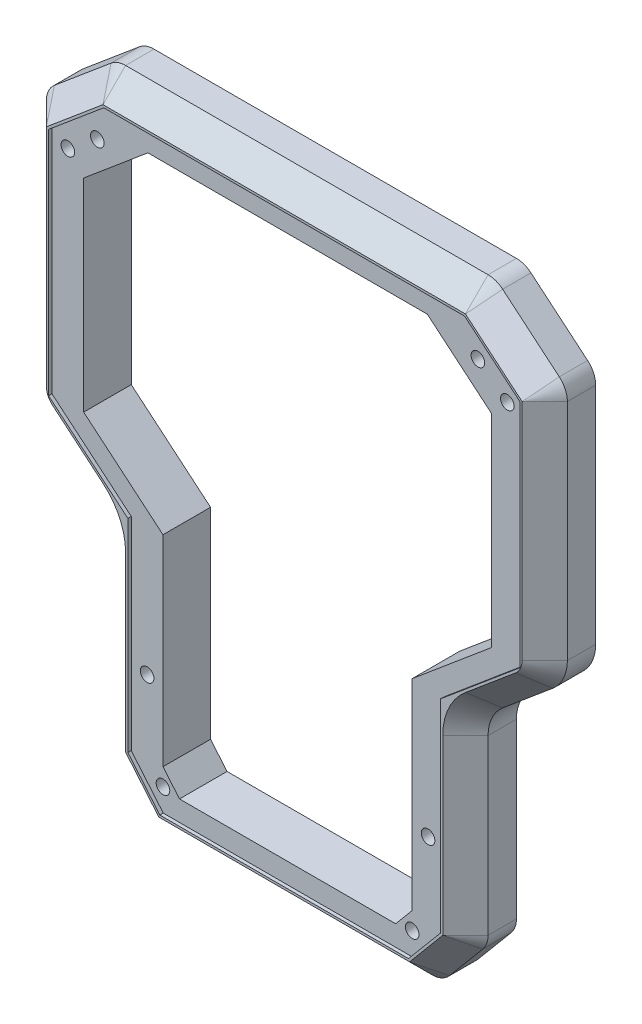
from build123d import *

# Parameters (mm, degrees)
RESSALTO_EXTRUS_O1_DEPTH = 22.5
CHANFRO1_SIZE            = 10
CORTE_EXTRUS_O1_REACH    = 305.531
ESBO_O3_W                = 1139.230904301
ESBO_O3_H                = 709.798033895
CORTE_EXTRUS_O5_DEPTH    = 1.5
ESBO_O5_R                = 3
CORTE_EXTRUS_O6_DEPTH    = 304.423796035
CORTE_EXTRUS_O8_DEPTH    = 10


with BuildPart() as part:
    # Esboço1 → Ressalto-extrusão1 (new, symmetric)
    with BuildSketch(Plane.XY):
        with BuildLine():
            Line((-55.336923418, 0), (55.336923418, 0))
            ThreePointArc((55.336923418, 0), (59.563106036, 0.93692213), (62.99736785, 3.572123903))
            Line((62.99736785, 3.572123903), (77.660444431, 21.046898098))
            ThreePointArc((77.660444431, 21.046898098), (79.396926208, 24.054572761), (80, 27.474774195))
            Line((80, 27.474774195), (80, 103.835071852))
            ThreePointArc((80, 103.835071852), (81.685949179, 111.43989715), (86.427876097, 117.619696626))
            Line((86.427876097, 117.619696626), (108.572123903, 136.200926793))
            ThreePointArc((108.572123903, 136.200926793), (113.314050821, 142.380726268), (115, 149.985551567))
            Line((115, 149.985551567), (115, 249.022509221))
            ThreePointArc((115, 249.022509221), (114.06307787, 253.248691838), (111.427876097, 256.682953652))
            Line((111.427876097, 256.682953652), (86.427876097, 277.660444431))
            ThreePointArc((86.427876097, 277.660444431), (83.420201433, 279.396926208), (80, 280))
            Line((80, 280), (-80, 280))
            ThreePointArc((-80, 280), (-83.420201433, 279.396926208), (-86.427876097, 277.660444431))
            Line((-86.427876097, 277.660444431), (-111.427876097, 256.682953652))
            ThreePointArc((-111.427876097, 256.682953652), (-114.06307787, 253.248691838), (-115, 249.022509221))
            Line((-115, 249.022509221), (-115, 149.985551567))
            ThreePointArc((-115, 149.985551567), (-113.314050821, 142.380726268), (-108.572123903, 136.200926793))
            Line((-108.572123903, 136.200926793), (-86.427876097, 117.619696626))
            ThreePointArc((-86.427876097, 117.619696626), (-81.685949179, 111.43989715), (-80, 103.835071852))
            Line((-80, 103.835071852), (-80, 27.474774195))
            ThreePointArc((-80, 27.474774195), (-79.396926208, 24.054572761), (-77.660444431, 21.046898098))
            Line((-77.660444431, 21.046898098), (-62.99736785, 3.572123903))
            ThreePointArc((-62.99736785, 3.572123903), (-59.563106036, 0.93692213), (-55.336923418, 0))
        make_face()
        Polygon((-90, 146.725210262), (-90, 236.228675506), (-61.670438633, 260), (61.670438633, 260), (90, 236.228675506), (90, 146.725210262), (55, 117.356723171), (55, 28.676328085), (47.719696304, 20), (-47.719696304, 20), (-55, 28.676328085), (-55, 117.356723171), align=None, mode=Mode.SUBTRACT)
    extrude(amount=RESSALTO_EXTRUS_O1_DEPTH, both=True)

    # Chanfro1
    chanfro1_edges = [part.edges().sort_by_distance(p)[0] for p in [
        (-70.32890614, 12.309511, 22.5),
        (-59.563106036, 0.93692213, 22.5),
        (0, 0, 22.5),
        (59.563106036, 0.93692213, 22.5),
        (70.32890614, 12.309511, 22.5),
        (79.396926208, 24.054572761, 22.5),
        (80, 65.654923023, 22.5),
        (81.685949179, 111.43989715, 22.5),
        (97.5, 126.910311709, 22.5),
        (113.314050821, 142.380726268, 22.5),
        (115, 199.504030394, 22.5),
        (114.06307787, 253.248691838, 22.5),
        (98.927876097, 267.171699041, 22.5),
        (98.927876097, 267.171699041, -22.5),
        (114.06307787, 253.248691838, -22.5),
        (115, 199.504030394, -22.5),
        (113.314050821, 142.380726268, -22.5),
        (97.5, 126.910311709, -22.5),
        (81.685949179, 111.43989715, -22.5),
        (80, 65.654923023, -22.5),
        (79.396926208, 24.054572761, -22.5),
        (70.32890614, 12.309511, -22.5),
        (59.563106036, 0.93692213, -22.5),
        (0, 0, -22.5),
        (-59.563106036, 0.93692213, -22.5),
        (-70.32890614, 12.309511, -22.5),
        (-79.396926208, 24.054572761, -22.5),
        (-80, 65.654923023, -22.5),
        (-81.685949179, 111.43989715, -22.5),
        (-97.5, 126.910311709, -22.5),
        (-113.314050821, 142.380726268, -22.5),
        (-115, 199.504030394, -22.5),
        (-114.06307787, 253.248691838, -22.5),
        (-98.927876097, 267.171699041, -22.5),
        (-83.420201433, 279.396926208, -22.5),
        (0, 280, -22.5),
        (83.420201433, 279.396926208, -22.5),
        (83.420201433, 279.396926208, 22.5),
        (0, 280, 22.5),
        (-83.420201433, 279.396926208, 22.5),
        (-98.927876097, 267.171699041, 22.5),
        (-114.06307787, 253.248691838, 22.5),
        (-115, 199.504030394, 22.5),
        (-113.314050821, 142.380726268, 22.5),
        (-97.5, 126.910311709, 22.5),
        (-81.685949179, 111.43989715, 22.5),
        (-80, 65.654923023, 22.5),
        (-79.396926208, 24.054572761, 22.5),
    ]]
    chamfer(chanfro1_edges, length=CHANFRO1_SIZE - 0.0001)  # a hair under: the kernel refuses the full size

    # Esboço3 → Corte-extrusão1 (cut, up to next)
    with BuildSketch(Plane.XY, mode=Mode.PRIVATE) as corte_extrus_o1_sk1:
        with Locations((-153.157436203, 152.53565808)):
            Rectangle(ESBO_O3_W, ESBO_O3_H)
    corte_extrus_o1_tool1 = extrude(corte_extrus_o1_sk1.sketch, amount=-CORTE_EXTRUS_O1_REACH, mode=Mode.PRIVATE) & part.part
    add(corte_extrus_o1_tool1.solids().sort_by_distance((-153.157436, 152.535658, 0))[0], mode=Mode.SUBTRACT)

    # Esboço4 → Corte-extrusão5 (cut)
    with BuildSketch(Plane.XY.offset(22.5)):
        Polygon((-69, 27.838744429), (-54.87061576, 11), (54.87061576, 11), (69, 27.838744429), (69, 117.355452403), (104, 146.723939495), (104, 248.556201562), (79.636029766, 269), (-79.636029766, 269), (-104, 248.556201562), (-104, 146.723939495), (-69, 117.355452403), align=None)
        Polygon((-90, 146.725210262), (-90, 236.228675506), (-61.670438633, 260), (61.670438633, 260), (90, 236.228675506), (90, 146.725210262), (55, 117.356723171), (55, 28.676328085), (47.719696304, 20), (-47.719696304, 20), (-55, 28.676328085), (-55, 117.356723171), align=None, mode=Mode.SUBTRACT)
    extrude(amount=-CORTE_EXTRUS_O5_DEPTH, mode=Mode.SUBTRACT)

    # Esboço5 → Corte-extrusão6 (cut, through all)
    with BuildSketch(Plane.XY.offset(21)):
        with Locations((-97, 244)):
            Circle(ESBO_O5_R)
        with Locations((-62, 60.396230411)):
            Circle(ESBO_O5_R)
        with Locations((-84, 254)):
            Circle(ESBO_O5_R)
        with Locations((-55, 21)):
            Circle(ESBO_O5_R)
        with Locations(Location((55, 21, 0), (0, 0, 180))):
            Circle(ESBO_O5_R)
        with Locations(Location((84, 254, 0), (0, 0, 180))):
            Circle(ESBO_O5_R)
        with Locations(Location((62, 60.396230411, 0), (0, 0, 180))):
            Circle(ESBO_O5_R)
        with Locations(Location((97, 244, 0), (0, 0, 180))):
            Circle(ESBO_O5_R)
    extrude(amount=-CORTE_EXTRUS_O6_DEPTH, mode=Mode.SUBTRACT)

    # Esboço7 → Corte-extrusão8 (cut)
    with BuildSketch(Plane(origin=(0, 0, 0), x_dir=(-1, 0, 0), z_dir=(0, 0, -1))):
        Polygon((83.862394336, 258.039108567), (80.43322654, 255.900384282), (80.570832205, 251.861275715), (84.137605664, 249.960891433), (87.56677346, 252.099615718), (87.429167795, 256.138724285), align=None)
        Polygon((-96.731346334, 248.032512683), (-100.357931592, 246.248917241), (-100.626585258, 242.216404558), (-97.268653666, 239.967487317), (-93.642068408, 241.751082759), (-93.373414742, 245.783595442), align=None)
        Polygon((-62, 64.437682295), (-65.5, 62.416956353), (-65.5, 58.375504468), (-62, 56.354778526), (-58.5, 58.375504468), (-58.5, 62.416956353), align=None)
        Polygon((-84, 258.041451884), (-87.5, 256.020725942), (-87.5, 251.979274058), (-84, 249.958548116), (-80.5, 251.979274058), (-80.5, 256.020725942), align=None)
        Polygon((54.761641425, 25.034416751), (51.386913316, 22.810783794), (51.625271892, 18.776367043), (55.238358575, 16.965583249), (58.613086684, 19.189216206), (58.374728108, 23.223632957), align=None)
        Polygon((62, 64.437682295), (58.5, 62.416956353), (58.5, 58.375504468), (62, 56.354778526), (65.5, 58.375504468), (65.5, 62.416956353), align=None)
        Polygon((97, 248.041451884), (93.5, 246.020725942), (93.5, 241.979274058), (97, 239.958548116), (100.5, 241.979274058), (100.5, 246.020725942), align=None)
        Polygon((-55.334155485, 25.027613865), (-58.655093666, 22.724419793), (-58.320938181, 18.696805928), (-54.665844515, 16.972386135), (-51.344906334, 19.275580207), (-51.679061819, 23.303194072), align=None)
    extrude(amount=-CORTE_EXTRUS_O8_DEPTH, mode=Mode.SUBTRACT)


solid = part.part
